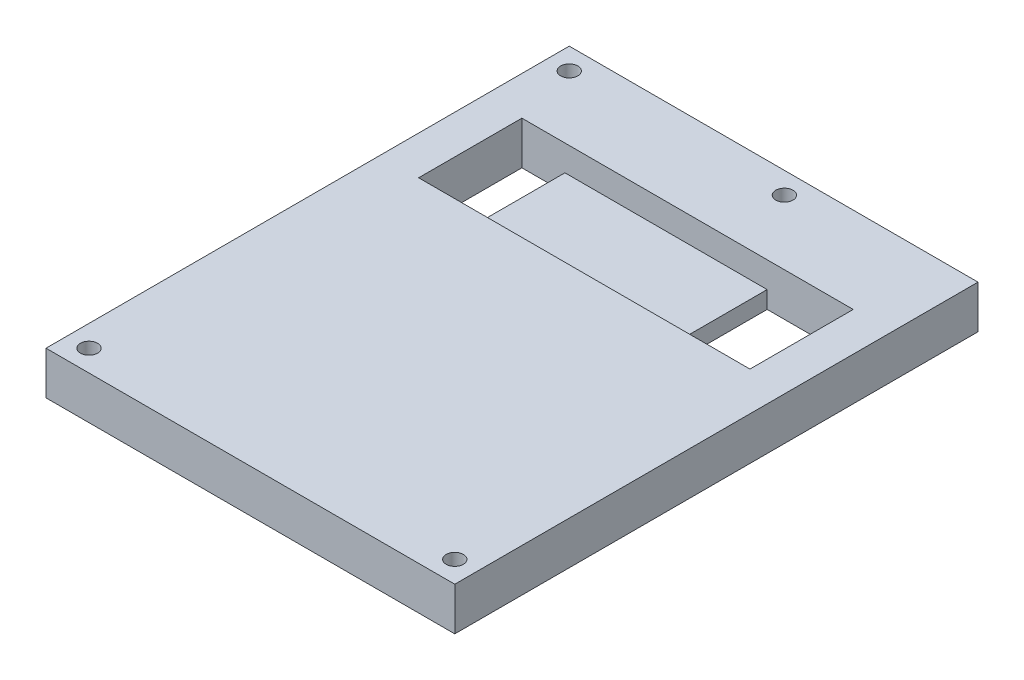
from build123d import *

# Parameters (mm, degrees)
SKETCH_1_W          = 47.5
SKETCH_1_H          = 60.8
EXTRUDE_1_DEPTH     = 5
SKETCH_2_W          = 38.5
SKETCH_2_H          = 12
CUT_EXTRUDE_1_DEPTH = 3
SKETCH_3_W          = 5
SKETCH_3_H          = 12
SKETCH_3_W_2        = 10
CUT_EXTRUDE_2_DEPTH = 2
SKETCH_4_R          = 1
CUT_EXTRUDE_3_DEPTH = 5


with BuildPart() as part:
    # 草图1 → 凸台-拉伸1 (new body)
    with BuildSketch(Plane(origin=(0, 0, 0), x_dir=(1, 0, 0), z_dir=(0, 1, 0))):
        with Locations((-30.655286344, 2.938237127)):
            Rectangle(SKETCH_1_W, SKETCH_1_H)
    extrude(amount=-EXTRUDE_1_DEPTH)

    # 草图2 → 切除-拉伸1 (cut)
    with BuildSketch(Plane(origin=(0, 0, 0), x_dir=(1, 0, 0), z_dir=(0, 1, 0))):
        with Locations((-30.655286344, 17.338237127)):
            Rectangle(SKETCH_2_W, SKETCH_2_H)
    extrude(amount=-CUT_EXTRUDE_1_DEPTH, mode=Mode.SUBTRACT)

    # 草图3 → 切除-拉伸2 (cut)
    with BuildSketch(Plane(origin=(0, -3, 0), x_dir=(1, 0, 0), z_dir=(0, 1, 0))):
        with Locations((-47.405286344, 17.338237127)):
            Rectangle(SKETCH_3_W, SKETCH_3_H)
        with Locations((-16.405286344, 17.338237127)):
            Rectangle(SKETCH_3_W_2, SKETCH_3_H)
    extrude(amount=-CUT_EXTRUDE_2_DEPTH, mode=Mode.SUBTRACT)

    # 草图4 → 切除-拉伸3 (cut)
    with BuildSketch(Plane(origin=(0, 0, 0), x_dir=(1, 0, 0), z_dir=(0, 1, 0))):
        with Locations((-9.405286344, -24.961762873)):
            Circle(SKETCH_4_R)
        with Locations((-51.905286344, -24.961762873)):
            Circle(SKETCH_4_R)
        with Locations((-51.905286344, 30.838237127)):
            Circle(SKETCH_4_R)
        with Locations((-26.905286344, 30.838237127)):
            Circle(SKETCH_4_R)
    extrude(amount=-CUT_EXTRUDE_3_DEPTH, mode=Mode.SUBTRACT)


solid = part.part
